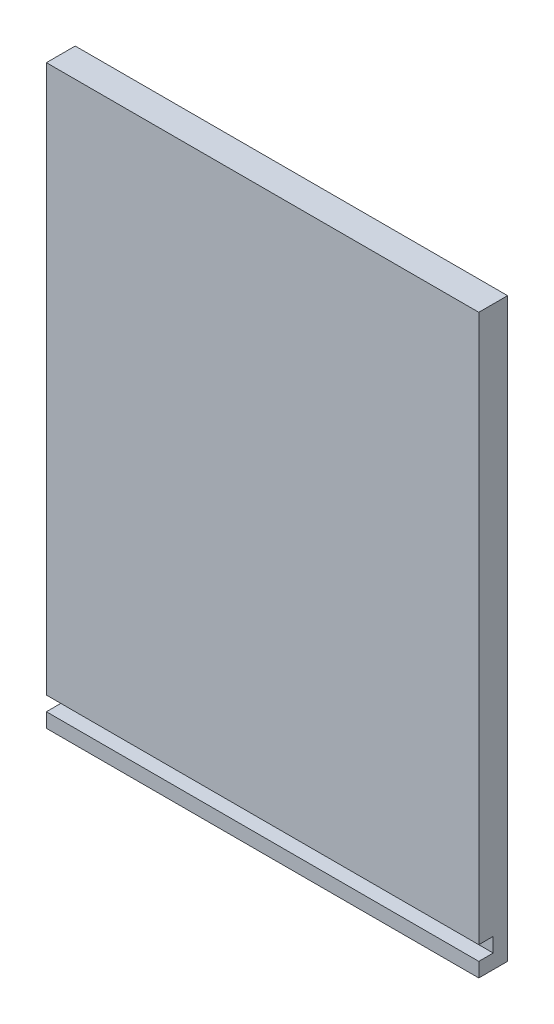
from build123d import *

# Parameters (mm, degrees)
SKETCH_1_W          = 150
SKETCH_1_H          = 200
EXTRUDE_1_DEPTH     = 10
SKETCH_2_W          = 150
SKETCH_2_H          = 5
CUT_EXTRUDE_1_DEPTH = 5


with BuildPart() as part:
    # ｽｹｯﾁ1 → ﾎﾞｽ - 押し出し1 (new body)
    with BuildSketch(Plane.XY):
        with Locations((21.019868277, 33.335714286)):
            Rectangle(SKETCH_1_W, SKETCH_1_H)
    extrude(amount=EXTRUDE_1_DEPTH)

    # ｽｹｯﾁ2 → ｶｯﾄ - 押し出し1 (cut)
    with BuildSketch(Plane.XY.offset(10)):
        with Locations((21.019868277, -59.164285714)):
            Rectangle(SKETCH_2_W, SKETCH_2_H)
    extrude(amount=-CUT_EXTRUDE_1_DEPTH, mode=Mode.SUBTRACT)


solid = part.part
